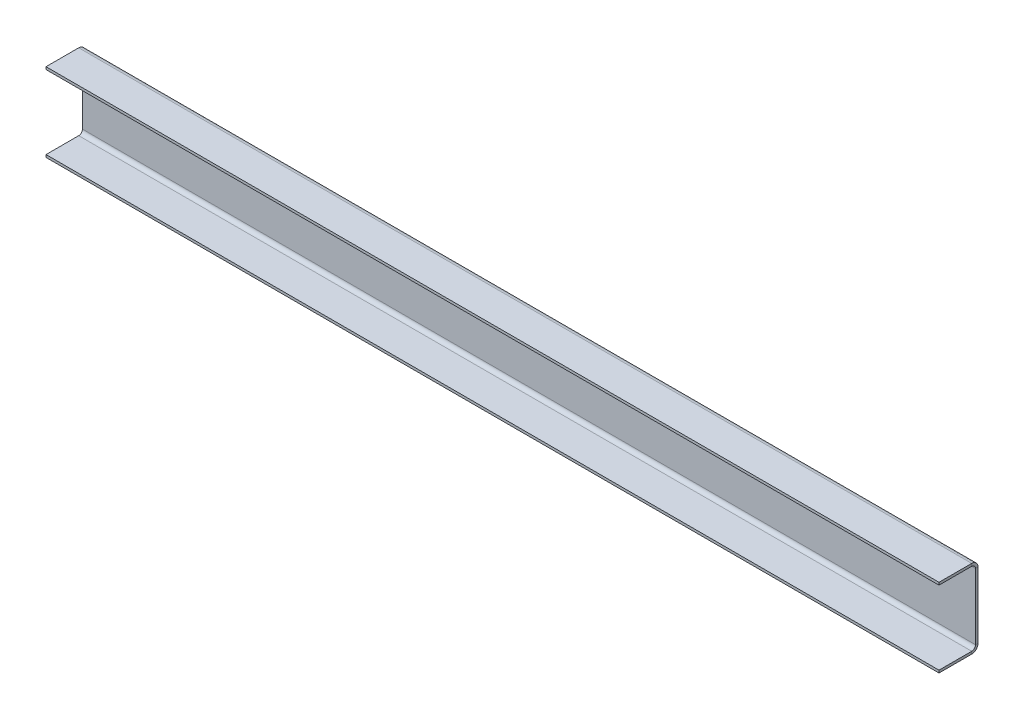
from build123d import *

# Parameters (mm, degrees)
SKETCH1_W                    = 1420
SKETCH1_H                    = 125
BASE_FLANGE1_DEPTH           = 4
EDGE_FLANGE1_STRIP_W         = 28
EDGE_FLANGE1_STRIP_H         = 4
EDGE_FLANGE1_STRIP_CUT_DEPTH = 1420
EDGE_FLANGE1_DEPTH           = 1420
EDGE_FLANGE2_STRIP_W         = 28
EDGE_FLANGE2_STRIP_H         = 4
EDGE_FLANGE2_STRIP_CUT_DEPTH = 1420
EDGE_FLANGE2_DEPTH           = 1420


# Sheet-metal steps are written as plain solids
with BuildPart() as part:
    # Sketch1 → Base-Flange1 (new body)
    with BuildSketch(Plane.XY):
        with Locations((-226.8723099, 44.386657102)):
            Rectangle(SKETCH1_W, SKETCH1_H)
    extrude(amount=-BASE_FLANGE1_DEPTH)

    # Edge-Flange1 strip (across the edge) → Edge-Flange1 strip cut (cut)
    with BuildSketch(Plane(origin=(483.1276901, 106.886657102, 0), x_dir=(0, -1, 0), z_dir=(-1, 0, 0))):
        with Locations((-4, -2)):
            Rectangle(EDGE_FLANGE1_STRIP_W, EDGE_FLANGE1_STRIP_H)
    extrude(amount=EDGE_FLANGE1_STRIP_CUT_DEPTH, mode=Mode.SUBTRACT)

    # Edge-Flange1 section (across the edge) → Edge-Flange1 (add)
    with BuildSketch(Plane(origin=(483.1276901, 106.886657102, 0), x_dir=(0, -1, 0), z_dir=(-1, 0, 0))):
        with BuildLine():
            Line((0, 6), (0, 58))
            Line((0, 58), (4, 58))
            Line((4, 58), (4, 6))
            ThreePointArc((4, 6), (5.757359313, 1.757359313), (10, 0))
            Line((10, 0), (10, -4))
            ThreePointArc((10, -4), (2.928932188, -1.071067812), (0, 6))
        make_face()
    extrude(amount=EDGE_FLANGE1_DEPTH)

    # Edge-Flange2 strip (across the edge) → Edge-Flange2 strip cut (cut)
    with BuildSketch(Plane(origin=(-936.8723099, -18.113342898, 0), x_dir=(0, 1, 0), z_dir=(1, 0, 0))):
        with Locations((-4, -2)):
            Rectangle(EDGE_FLANGE2_STRIP_W, EDGE_FLANGE2_STRIP_H)
    extrude(amount=EDGE_FLANGE2_STRIP_CUT_DEPTH, mode=Mode.SUBTRACT)

    # Edge-Flange2 section (across the edge) → Edge-Flange2 (add)
    with BuildSketch(Plane(origin=(-936.8723099, -18.113342898, 0), x_dir=(0, 1, 0), z_dir=(1, 0, 0))):
        with BuildLine():
            Line((0, 6), (0, 58))
            Line((0, 58), (4, 58))
            Line((4, 58), (4, 6))
            ThreePointArc((4, 6), (5.757359313, 1.757359313), (10, 0))
            Line((10, 0), (10, -4))
            ThreePointArc((10, -4), (2.928932188, -1.071067812), (0, 6))
        make_face()
    extrude(amount=EDGE_FLANGE2_DEPTH)


solid = part.part
